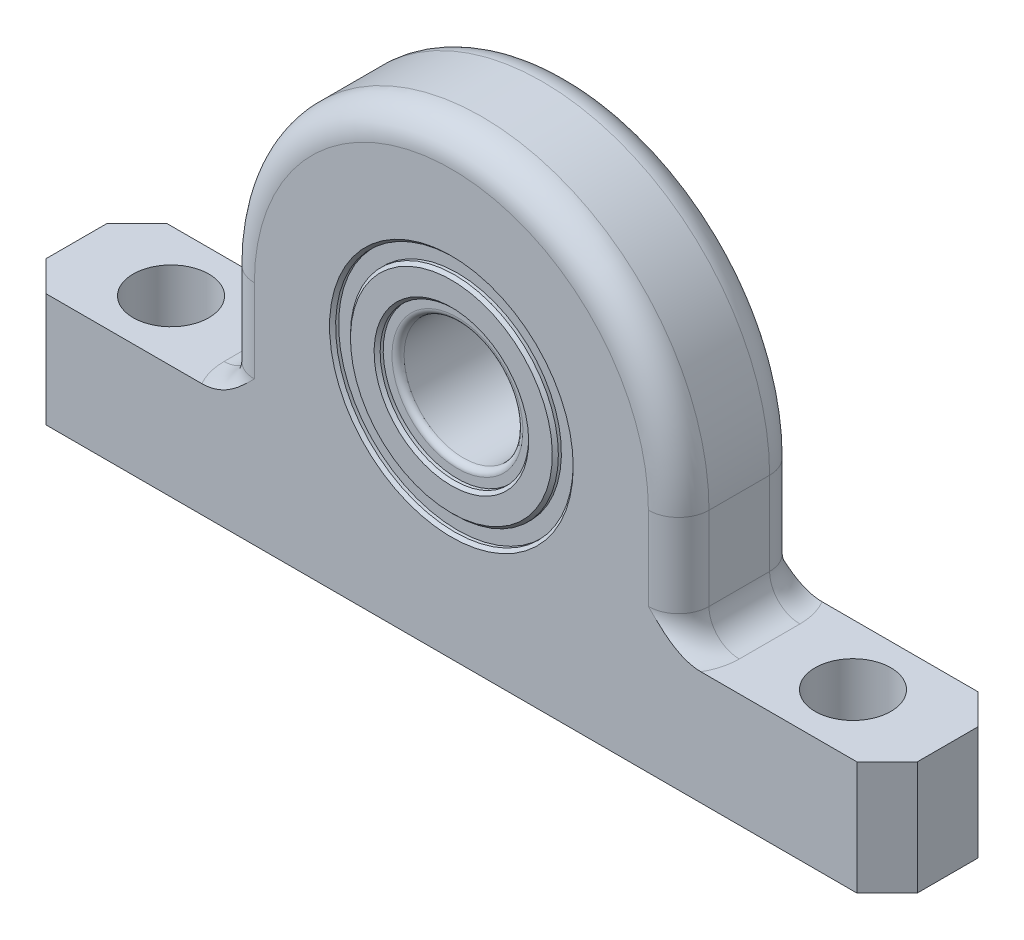
from build123d import *

# Parameters (mm, degrees)
EXTRUDE1_DEPTH      = 2.54
EXTRUDE1_DEPTH_BACK = 2.54
SKETCH3_R           = 4.9784
SKETCH4_R           = 1.5875
CUT_EXTRUDE1_DEPTH  = 24.321126052
FILLET1_R           = 1.27
FILLET2_R           = 1.27
CHAMFER1_SIZE       = 0.127
FILLET3_R           = 0.254
CHAMFER2_SIZE       = 0.127


with BuildPart() as part:
    # Sketch3 → Extrude1 (new, two sides: drawn at the far end of the back side and taken through both)
    with BuildSketch(Plane.XY.offset(-EXTRUDE1_DEPTH_BACK)):
        with BuildLine():
            Line((9.525, 0), (9.525, -4.7625))
            Line((9.525, -4.7625), (18.25625, -4.7625))
            Line((18.25625, -4.7625), (18.25625, -9.525))
            Line((18.25625, -9.525), (-18.25625, -9.525))
            Line((-18.25625, -9.525), (-18.25625, -4.7625))
            Line((-18.25625, -4.7625), (-9.525, -4.7625))
            Line((-9.525, -4.7625), (-9.525, 0))
            ThreePointArc((-9.525, 0), (0, 9.525), (9.525, 0))
        make_face()
        Circle(SKETCH3_R, mode=Mode.SUBTRACT)
    extrude(amount=EXTRUDE1_DEPTH + EXTRUDE1_DEPTH_BACK)

    # Sketch4 → Cut-Extrude1 (cut, through all)
    with BuildSketch(Plane(origin=(0, -4.7625, 0), x_dir=(1, 0, 0), z_dir=(0, 1, 0))):
        with Locations(Location((-14.2875, 0, 0), (0, 0, 270))):
            Circle(SKETCH4_R)
        with Locations(Location((14.2875, 0, 0), (0, 0, 270))):
            Circle(SKETCH4_R)
        Polygon((-18.25625, 2.54), (-18.25625, 1.27), (-16.98625, 2.54), align=None)
        Polygon((16.98625, 2.54), (18.25625, 2.54), (18.25625, 1.27), align=None)
        Polygon((18.25625, -2.54), (18.25625, -1.27), (16.98625, -2.54), align=None)
        Polygon((-16.98625, -2.54), (-18.25625, -2.54), (-18.25625, -1.27), align=None)
    extrude(amount=-CUT_EXTRUDE1_DEPTH, mode=Mode.SUBTRACT)

    # Fillet1
    fillet1_edges = [part.edges().sort_by_distance(p)[0] for p in [
        (0, 9.525, -2.54),
        (9.525, -2.38125, -2.54),
        (9.525, -2.38125, 2.54),
        (-9.525, -2.38125, -2.54),
        (0, 9.525, 2.54),
        (-9.525, -2.38125, 2.54),
    ]]
    fillet(fillet1_edges, radius=FILLET1_R)

    # Fillet2
    # the kernel refuses this fillet: 1.27 mm, written as the material it adds along each edge
    with BuildSketch(Plane(origin=(-9.525, -4.7625, -1.27), x_dir=(0, 1, 0), z_dir=(0, 0, 1)), Plane(origin=(9.525, -4.7625, 1.27), x_dir=(0, 1, 0), z_dir=(0, 0, -1))) as fillet2_piece_1:
        with BuildLine():
            CenterArc((FILLET2_R, FILLET2_R), FILLET2_R, 180, 90)
            Line((0, FILLET2_R), (0, 0))
            Line((0, 0), (FILLET2_R, 0))
        make_face()
    extrude(amount=2.54)
    with BuildSketch(Plane(origin=(8.255, -4.7625, -1.27), x_dir=(-0.5976672776328268, 0, 0.8017442392976488), z_dir=(0.8017442392976488, 0, 0.5976672776328268))) as fillet2_piece_2_section:
        with BuildLine():
            CenterArc((1.27 + FILLET2_R, -FILLET2_R), FILLET2_R, 90, 90)
            Line((1.27 + FILLET2_R, 0), (1.27, 0))
            Line((1.27, 0), (1.27, -FILLET2_R))
        make_face()
    fillet2_piece_2 = revolve(axis=Axis((8.255, -4.7625, -1.27), (0, -1, 0)), revolution_arc=233.296989237, mode=Mode.PRIVATE)
    fillet2_piece_2 = split(fillet2_piece_2, bisect_by=Plane(origin=(9.207422318, -4.366731678, -2.54), z_dir=(0, 0, 1)), keep=Keep.TOP, mode=Mode.PRIVATE)
    add(fillet2_piece_2)
    with BuildSketch(Plane(origin=(-8.255, -4.7625, -1.27), x_dir=(0.5976672776328281, 0, 0.8017442392976479), z_dir=(-0.8017442392976479, 0, 0.5976672776328281))) as fillet2_piece_3_section:
        with BuildLine():
            CenterArc((1.27 + FILLET2_R, FILLET2_R), FILLET2_R, 180, 90)
            Line((1.27, FILLET2_R), (1.27, 0))
            Line((1.27, 0), (1.27 + FILLET2_R, 0))
        make_face()
    fillet2_piece_3 = revolve(axis=Axis((-8.255, -4.7625, -1.27), (0, 1, 0)), revolution_arc=233.296989237, mode=Mode.PRIVATE)
    fillet2_piece_3 = split(fillet2_piece_3, bisect_by=Plane(origin=(-9.207422451, -4.366732131, -2.54), z_dir=(0, 0, 1)), keep=Keep.TOP, mode=Mode.PRIVATE)
    add(fillet2_piece_3)
    with BuildSketch(Plane(origin=(8.255, -4.7625, 1.27), x_dir=(1, 0, 0), z_dir=(0, 0, -1))) as fillet2_piece_4_section:
        with BuildLine():
            CenterArc((1.27 + FILLET2_R, -FILLET2_R), FILLET2_R, 90, 90)
            Line((1.27 + FILLET2_R, 0), (1.27, 0))
            Line((1.27, 0), (1.27, -FILLET2_R))
        make_face()
    fillet2_piece_4 = revolve(axis=Axis((8.255, -4.7625, 1.27), (0, -1, 0)), revolution_arc=233.296989237, mode=Mode.PRIVATE)
    fillet2_piece_4 = split(fillet2_piece_4, bisect_by=Plane(origin=(9.207422382, -4.366731938, 2.54), z_dir=(0, 0, -1)), keep=Keep.TOP, mode=Mode.PRIVATE)
    add(fillet2_piece_4)
    with BuildSketch(Plane(origin=(-8.255, -4.7625, 1.27), x_dir=(-1, 0, 0), z_dir=(0, 0, -1))) as fillet2_piece_5_section:
        with BuildLine():
            CenterArc((1.27 + FILLET2_R, FILLET2_R), FILLET2_R, 180, 90)
            Line((1.27, FILLET2_R), (1.27, 0))
            Line((1.27, 0), (1.27 + FILLET2_R, 0))
        make_face()
    fillet2_piece_5 = revolve(axis=Axis((-8.255, -4.7625, 1.27), (0, 1, 0)), revolution_arc=233.296989237, mode=Mode.PRIVATE)
    fillet2_piece_5 = split(fillet2_piece_5, bisect_by=Plane(origin=(-9.804114567, -4.550028742, 2.54), z_dir=(0, 0, -1)), keep=Keep.TOP, mode=Mode.PRIVATE)
    add(fillet2_piece_5)

    # Chamfer1
    chamfer1_edges = [part.edges().sort_by_distance(p)[0] for p in [
        (-4.9784, 0, 2.54),
        (-4.9784, 0, -2.54),
    ]]
    chamfer(chamfer1_edges, length=CHAMFER1_SIZE)

    # Sketch5 → Revolve1 (revolve)
    with BuildSketch(Plane(origin=(0, 0, 0), x_dir=(0, 0, -1), z_dir=(1, 0, 0))):
        Polygon((-2.286, 4.9784), (-2.286, 4.3561), (-2.54, 4.3561), (-2.54, 3.1115), (-2.286, 3.1115), (-2.286, 2.4892), (2.286, 2.4892), (2.286, 3.1115), (2.54, 3.1115), (2.54, 4.3561), (2.286, 4.3561), (2.286, 4.9784), align=None)
    revolve(axis=Axis((0, 0, 0), (0, 0, 1)))

    # Fillet3
    fillet3_edges = [part.edges().sort_by_distance(p)[0] for p in [
        (0, -2.4892, -2.286),
        (0, -2.4892, 2.286),
    ]]
    fillet(fillet3_edges, radius=FILLET3_R)

    # Chamfer2
    chamfer2_edges = [part.edges().sort_by_distance(p)[0] for p in [
        (0, -4.3561, -2.54),
        (0, -3.1115, -2.54),
        (0, -3.1115, 2.54),
        (0, -4.3561, 2.54),
    ]]
    chamfer(chamfer2_edges, length=CHAMFER2_SIZE)


solid = part.part
